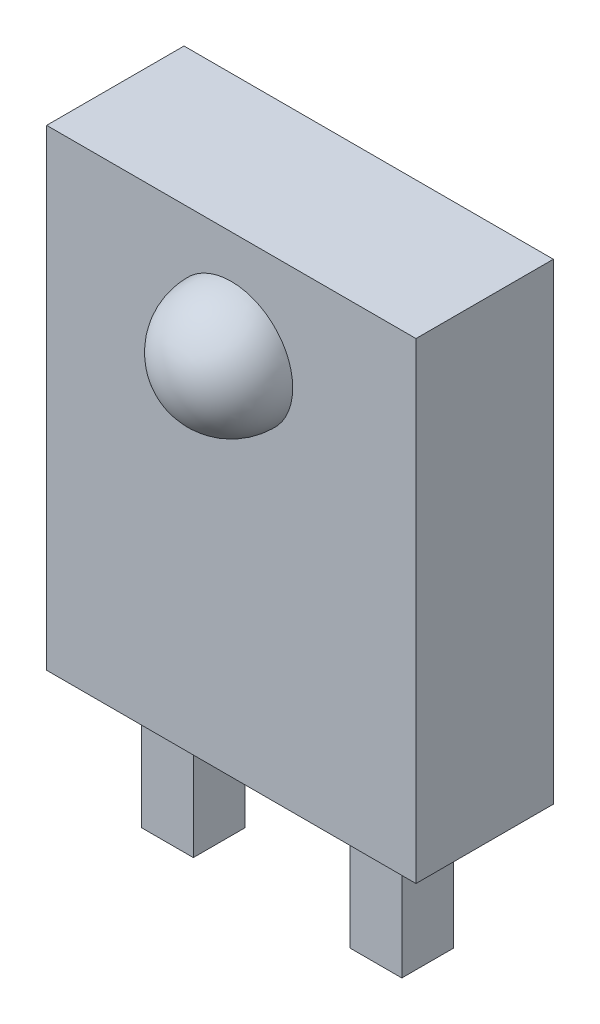
from build123d import *

# Parameters (mm, degrees)
BOSS_EXTRUDE1_DEPTH      = 1.14
BOSS_EXTRUDE1_DEPTH_BACK = 0.56
SKETCH2_W                = 4.57
SKETCH2_H                = 5.84
SKETCH3_R                = 0.76
BOSS_EXTRUDE2_DEPTH      = 0.76
FILLET1_R                = 0.76
SKETCH4_W                = 0.64
SKETCH4_H                = 0.64
BOSS_EXTRUDE3_DEPTH      = 1.6
SKETCH5_W                = 0.64
SKETCH5_H                = 0.64
BOSS_EXTRUDE4_DEPTH      = 1.6


with BuildPart() as part:
    # Sketch2 → Boss-Extrude1 (new, two sides: drawn at the far end of the back side and taken through both)
    with BuildSketch(Plane.XY.offset(-BOSS_EXTRUDE1_DEPTH_BACK)):
        Rectangle(SKETCH2_W, SKETCH2_H)
    extrude(amount=BOSS_EXTRUDE1_DEPTH + BOSS_EXTRUDE1_DEPTH_BACK)

    # Sketch3 → Boss-Extrude2 (add)
    with BuildSketch(Plane.XY.offset(1.14)):
        with Locations(Location((0, 1.63, 0), (0, 0, 180))):
            Circle(SKETCH3_R)
    extrude(amount=BOSS_EXTRUDE2_DEPTH)

    # Fillet1
    fillet1_edges = [part.edges().sort_by_distance(p)[0] for p in [
        (0.76, 1.63, 1.9),
    ]]
    fillet(fillet1_edges, radius=FILLET1_R - 0.0001)  # a hair under: the kernel refuses the full size

    # Sketch4 → Boss-Extrude3 (add)
    with BuildSketch(Plane.XZ.offset(2.92)):
        with Locations((1.29, 0.32)):
            Rectangle(SKETCH4_W, SKETCH4_H)
    extrude(amount=BOSS_EXTRUDE3_DEPTH)

    # Sketch5 → Boss-Extrude4 (add)
    with BuildSketch(Plane.XZ.offset(2.92)):
        with Locations((-1.29, 0.32)):
            Rectangle(SKETCH5_W, SKETCH5_H)
    extrude(amount=BOSS_EXTRUDE4_DEPTH)


solid = part.part
